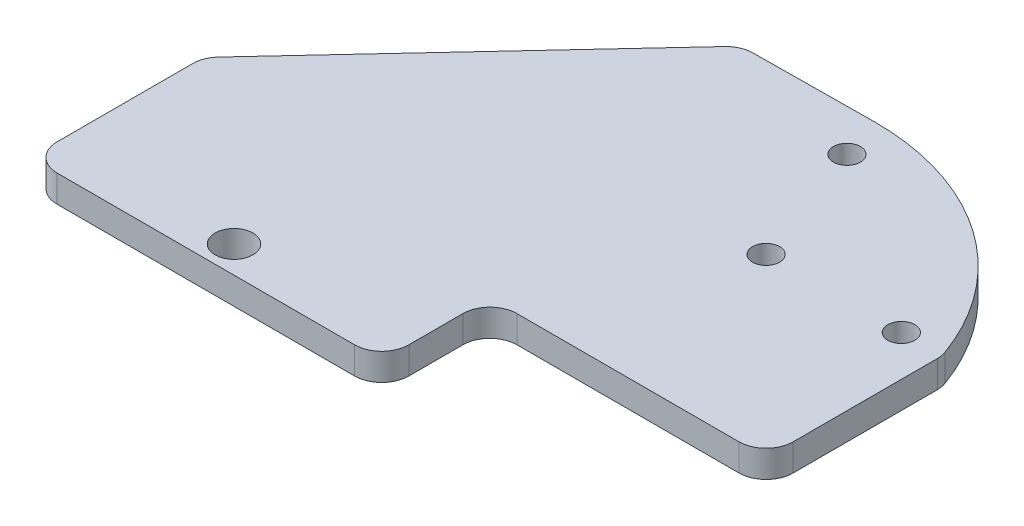
from build123d import *

# Parameters (mm, degrees)
BOSS_EXTRUDE1_DEPTH     = 10
CUT_EXTRUDE4_DEPTH      = 186.960345235
CUT_EXTRUDE4_DEPTH_BACK = 186.960345235
SKETCH2_R               = 5
SKETCH3_R               = 7
CUT_EXTRUDE5_DEPTH      = 186.960345235


with BuildPart() as part:
    # Sketch1 → Boss-Extrude1 (new body)
    with BuildSketch(Plane(origin=(0, 0, 0), x_dir=(1, 0, 0), z_dir=(0, 1, 0))):
        with BuildLine():
            Line((5, 0), (87.1, 0))
            ThreePointArc((87.1, 0), (94.171067812, 2.928932188), (97.1, 10))
            Line((97.1, 10), (97.1, 63.297208828))
            ThreePointArc((97.1, 63.297208828), (96.949532816, 65.025416948), (96.502659338, 66.701617347))
            ThreePointArc((96.502659338, 66.701617347), (62.853663281, 110.72240479), (10.046495568, 127.5))
            Line((10.046495568, 127.5), (-34.953504432, 127.079547292))
            ThreePointArc((-34.953504432, 127.079547292), (-38.861917641, 126.217874558), (-42.119413536, 123.892601626))
            Line((-42.119413536, 123.892601626), (-132.321113421, 26.947294417))
            ThreePointArc((-132.321113421, 26.947294417), (-134.306211211, 23.795285131), (-135, 20.135444575))
            Line((-135, 20.135444575), (-135, -30))
            ThreePointArc((-135, -30), (-132.071067812, -37.071067812), (-125, -40))
            Line((-125, -40), (-15, -40))
            ThreePointArc((-15, -40), (-7.928932188, -37.071067812), (-5, -30))
            Line((-5, -30), (-5, -10))
            ThreePointArc((-5, -10), (-2.071067812, -2.928932188), (5, 0))
        make_face()
    extrude(amount=BOSS_EXTRUDE1_DEPTH)

    # Sketch2 → Cut-Extrude4 (cut, two sides: drawn at the far end of the back side and taken through both)
    with BuildSketch(Plane(origin=(0, 0, 0), x_dir=(1, 0, 0), z_dir=(0, 1, 0)).offset(-CUT_EXTRUDE4_DEPTH_BACK)):
        with Locations((14.998992834, 111.984631039)):
            Circle(SKETCH2_R)
        with Locations((82.1, 65)):
            Circle(SKETCH2_R)
        with Locations((32.1, 65)):
            Circle(SKETCH2_R)
    extrude(amount=CUT_EXTRUDE4_DEPTH + CUT_EXTRUDE4_DEPTH_BACK, mode=Mode.SUBTRACT)

    # Sketch3 → Cut-Extrude5 (cut, through all)
    with BuildSketch(Plane.XZ):
        with Locations((-69.615384615, 30)):
            Circle(SKETCH3_R)
    extrude(amount=-CUT_EXTRUDE5_DEPTH, mode=Mode.SUBTRACT)


solid = part.part
